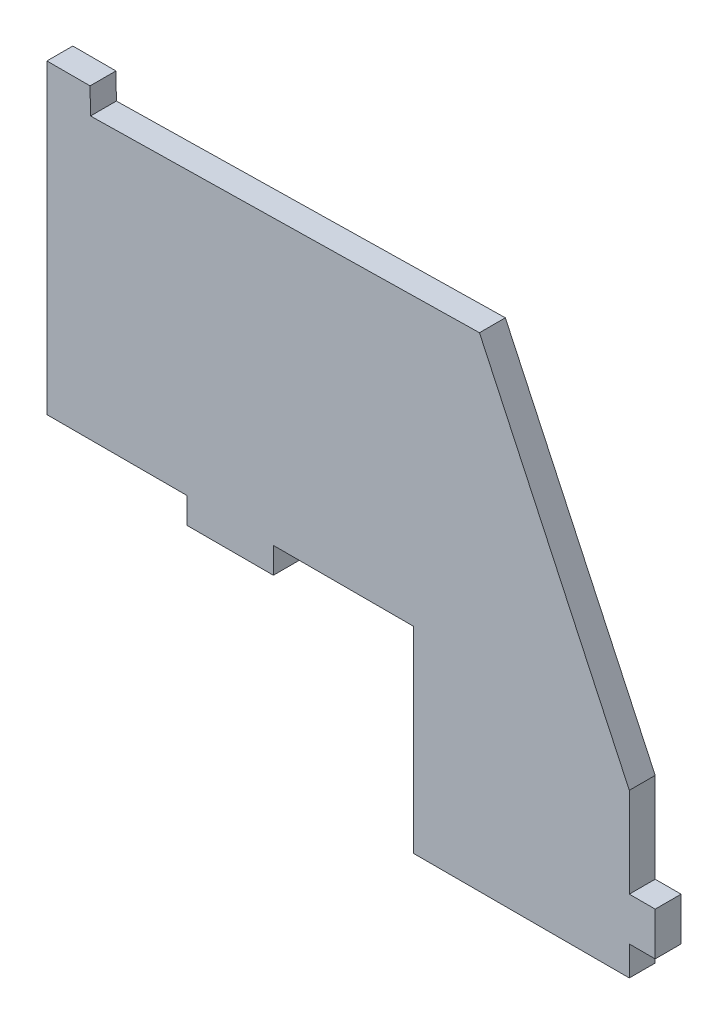
from build123d import *

# Parameters (mm, degrees)
BOSS_EXTRU_2_DEPTH = 6
ESQUISSE3_W        = 20
ESQUISSE3_H        = 6
ESQUISSE3_W_2      = 6
ESQUISSE3_H_2      = 10
BOSS_EXTRU_4_DEPTH = 6


with BuildPart() as part:
    # Esquisse1 → Boss.-Extru.2 (new body)
    with BuildSketch(Plane.XY):
        Polygon((-76.070917334, 85.270523389), (-76.070917334, 79.272350908), (-76.070917334, 59.272350908), (-76.070917334, 14.270523389), (8.924804006, 14.270523389), (8.924804006, -31.319476611), (58.924804006, -31.319476611), (58.924804006, 6.353617043), (24.188432468, 80.846006201), (-65.966218844, 79.272350908), (-66.070917334, 85.270523389), align=None)
    extrude(amount=BOSS_EXTRU_2_DEPTH)

    # Esquisse3 → Boss.-Extru.4 (add)
    with BuildSketch(Plane.XY.offset(6)):
        with Locations((-33.575195994, 11.270523389)):
            Rectangle(ESQUISSE3_W, ESQUISSE3_H)
        with Locations((61.924804006, -19.489476611)):
            Rectangle(ESQUISSE3_W_2, ESQUISSE3_H_2)
    extrude(amount=-BOSS_EXTRU_4_DEPTH)


solid = part.part
